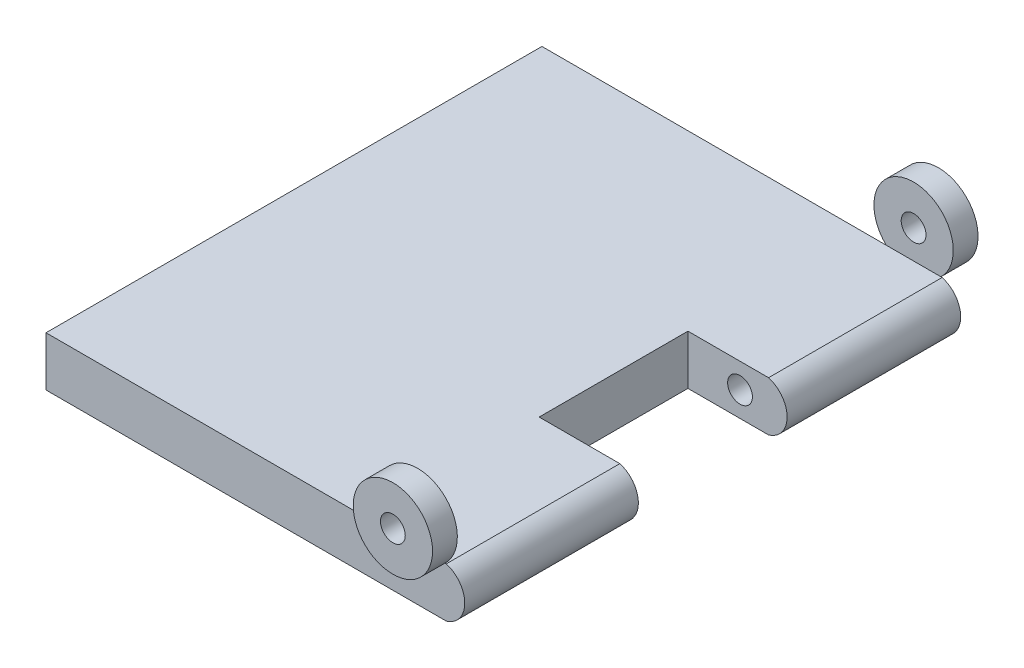
from build123d import *

# Parameters (mm, degrees)
SKETCH1_W           = 66.321579053
SKETCH1_H           = 6.35
BOSS_EXTRUDE2_DEPTH = 63.5
SKETCH2_W           = 19.05
SKETCH2_H           = 6.35
CUT_EXTRUDE1_DEPTH  = 25.4
SKETCH3_R           = 1.5875
CUT_EXTRUDE2_DEPTH  = 12.7
CUT_EXTRUDE3_START  = -12.7
SKETCH4_R           = 1.5875
CUT_EXTRUDE3_DEPTH  = 12.7
SKETCH5_R           = 5.08
SKETCH5_R_2         = 1.5875
BOSS_EXTRUDE3_DEPTH = 3.175
BOSS_EXTRUDE4_START = 3.175
SKETCH6_R           = 5.08
SKETCH6_R_2         = 1.5875
BOSS_EXTRUDE4_DEPTH = 3.175
SKETCH7_W           = 12.7
SKETCH7_H           = 22.225
CUT_EXTRUDE4_DEPTH  = 6.35
CUT_EXTRUDE5_START  = -22.225
CUT_EXTRUDE5_DEPTH  = 22.225
CUT_EXTRUDE8_START  = -22.225
CUT_EXTRUDE8_DEPTH  = 22.225


# Read off the part's stored shape, not the designer's step: Cut-Extrude5, Cut-Extrude8
with BuildPart() as part:
    # Sketch1 → Boss-Extrude2 (new body)
    with BuildSketch(Plane.XY):
        with Locations((-33.160789527, 5.715)):
            Rectangle(SKETCH1_W, SKETCH1_H)
    extrude(amount=BOSS_EXTRUDE2_DEPTH)

    # Sketch2 → Cut-Extrude1 (cut)
    with BuildSketch(Plane(origin=(0, 0, 0), x_dir=(0, 0, -1), z_dir=(1, 0, 0))):
        with Locations((-31.75, 5.715)):
            Rectangle(SKETCH2_W, SKETCH2_H)
    extrude(amount=-CUT_EXTRUDE1_DEPTH, mode=Mode.SUBTRACT)

    # Sketch3 → Cut-Extrude2 (cut)
    with BuildSketch(Plane(origin=(0, 0, 41.275), x_dir=(-1, 0, 0), z_dir=(0, 0, -1))):
        with Locations((18.7325, 5.715)):
            Circle(SKETCH3_R)
    extrude(amount=-CUT_EXTRUDE2_DEPTH, mode=Mode.SUBTRACT)

    # Sketch4 → Cut-Extrude3 (cut)
    with BuildSketch(Plane.XY.offset(22.225).offset(CUT_EXTRUDE3_START)):
        with Locations(Location((-18.7325, 5.715, 0), (0, 0, 180))):
            Circle(SKETCH4_R)
    extrude(amount=CUT_EXTRUDE3_DEPTH, mode=Mode.SUBTRACT)

    # Sketch5 → Boss-Extrude3 (add)
    with BuildSketch(Plane.XY.offset(63.5)):
        with Locations(Location((-18.7325, 12.573, 0), (0, 0, 226.468847833))):
            Circle(SKETCH5_R)
        with Locations((-18.7325, 12.573)):
            Circle(SKETCH5_R_2, mode=Mode.SUBTRACT)
    extrude(amount=BOSS_EXTRUDE3_DEPTH)

    # Sketch6 → Boss-Extrude4 (add)
    with BuildSketch(Plane(origin=(0, 0, 0), x_dir=(-1, 0, 0), z_dir=(0, 0, -1)).offset(BOSS_EXTRUDE4_START)):
        with Locations(Location((18.7325, 12.573, 0), (0, 0, 313.531152167))):
            Circle(SKETCH6_R)
        with Locations(Location((18.7325, 12.573, 0), (0, 0, 180))):
            Circle(SKETCH6_R_2, mode=Mode.SUBTRACT)
    extrude(amount=-BOSS_EXTRUDE4_DEPTH)

    # Sketch7 → Cut-Extrude4 (cut)
    with BuildSketch(Plane(origin=(0, 8.89, 0), x_dir=(1, 0, 0), z_dir=(0, 1, 0))):
        with Locations((-6.35, -11.1125)):
            Rectangle(SKETCH7_W, SKETCH7_H)
        with Locations((-6.35, -52.3875)):
            Rectangle(SKETCH7_W, SKETCH7_H)
    extrude(amount=-CUT_EXTRUDE4_DEPTH, mode=Mode.SUBTRACT)

    # Cut-Extrude5 outline → Cut-Extrude5 (cut)
    with BuildSketch(Plane(origin=(0, 0, 41.275), x_dir=(-1, 0, 0), z_dir=(0, 0, -1)).offset(CUT_EXTRUDE5_START)):
        with BuildLine():
            Line((12.7, 2.54), (15.068097478, 2.54))
            ThreePointArc((15.068097478, 2.54), (13.357223916, 3.734563769), (12.7, 5.715))
            Line((12.7, 5.715), (12.7, 2.54))
        make_face()
        with BuildLine():
            Line((12.7, 8.89), (12.7, 5.715))
            ThreePointArc((12.7, 5.715), (13.357223916, 7.695436231), (15.068097478, 8.89))
            Line((15.068097478, 8.89), (12.7, 8.89))
        make_face()
    extrude(amount=CUT_EXTRUDE5_DEPTH, mode=Mode.SUBTRACT)

    # Cut-Extrude8 outline → Cut-Extrude8 (cut)
    with BuildSketch(Plane.XY.offset(22.225).offset(CUT_EXTRUDE8_START)):
        with BuildLine():
            Line((-12.7, 8.89), (-15.0749, 8.89))
            ThreePointArc((-15.0749, 8.89), (-13.359413065, 7.697471627), (-12.7, 5.715))
            Line((-12.7, 5.715), (-12.7, 8.89))
        make_face()
        with BuildLine():
            Line((-12.7, 2.54), (-12.7, 5.715))
            ThreePointArc((-12.7, 5.715), (-13.359413065, 3.732528373), (-15.0749, 2.54))
            Line((-15.0749, 2.54), (-12.7, 2.54))
        make_face()
    extrude(amount=CUT_EXTRUDE8_DEPTH, mode=Mode.SUBTRACT)


solid = part.part
